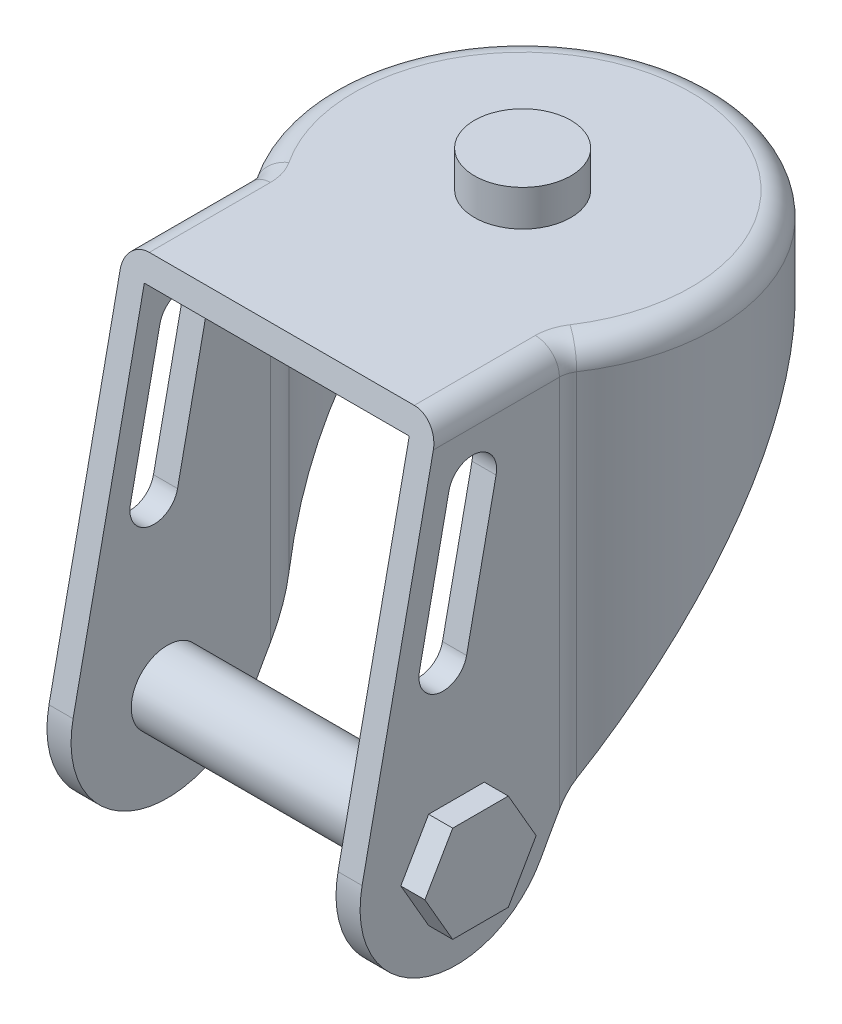
from build123d import *

# Parameters (mm, degrees)
BASE_EXTRUDE_DEPTH              = 33.02
SKETCH3_OUTSIDE_W               = 90.796
SKETCH3_OUTSIDE_H               = 92.225
CUT_EXTRUDE1_DEPTH              = 84.020179032
FILLET1_R                       = 3.175
SHELL1_START                    = -64
SHELL1_DEPTH                    = 60.825
CUT_EXTRUDE2_DEPTH              = 90.002703004
BOSS_EXTRUDE2_REACH             = 82.294
SKETCH5_R                       = 4.7625
BOSS_EXTRUDE2_DIRECTION_2_REACH = 82.294
BOSS_EXTRUDE3_DEPTH             = 3.175
SKETCH7_R                       = 6.35
BOSS_EXTRUDE4_DEPTH             = 4.7625


with BuildPart() as part:
    # Sketch2 → Base-Extrude (new, symmetric)
    with BuildSketch(Plane.ZY):
        with BuildLine():
            Line((-25.4, 0), (31.75, 0))
            Line((31.75, 0), (41.801384237, -48.20777973))
            ThreePointArc((41.801384237, -48.20777973), (33.708556891, -62.735496477), (18.174681196, -56.798568464))
            ThreePointArc((18.174681196, -56.798568464), (-0.820496403, -29.162568375), (-25.4, -6.35))
            Line((-25.4, -6.35), (-25.4, 0))
        make_face()
    extrude(amount=BASE_EXTRUDE_DEPTH, both=True)

    # Sketch3 outside → Cut-Extrude1 (cut, through all)
    with BuildSketch(Plane(origin=(0, 0, 0), x_dir=(-1, 0, 0), z_dir=(0, 1, 0))):
        with Locations((0, 8.3345)):
            Rectangle(SKETCH3_OUTSIDE_W, SKETCH3_OUTSIDE_H)
        with BuildLine():
            Line((20.6375, 14.807214247), (20.6375, 48.151384237))
            Line((20.6375, 48.151384237), (-20.6375, 48.151384237))
            Line((-20.6375, 48.151384237), (-20.6375, 14.807214247))
            ThreePointArc((-20.6375, 14.807214247), (0, -25.4), (20.6375, 14.807214247))
        make_face(mode=Mode.SUBTRACT)
    extrude(amount=-CUT_EXTRUDE1_DEPTH, mode=Mode.SUBTRACT)

    # Fillet1
    # the kernel refuses this fillet: 3.175 mm, written as the material it adds along each edge
    with BuildSketch(Plane(origin=(20.6375, 0, 14.807214247), x_dir=(0.567961525786319, 0, -0.8230551046111534), z_dir=(0, -1, 0))) as fillet1_piece_1_section:
        with BuildLine():
            CenterArc((0.989925475, 3.174465965), FILLET1_R, 235.391801271, 33.557309762)
            Line((-0.813352369, 0.561266008), (0, 0))
            ThreePointArc((0, 0), (0.465847282, 0.004272282), (0.931694565, 0))
        make_face()
    fillet1_piece_1 = extrude(amount=53.310385567, mode=Mode.PRIVATE)
    fillet1_piece_1 = fillet1_piece_1 - Plane(origin=(20.6375, -128.781390034, -116.154144448), x_dir=(0, 0.4723282255219985, 0.8814227404459453), z_dir=(-1, 0, 0)) * Cylinder(152.4, 111, mode=Mode.PRIVATE)
    add(fillet1_piece_1)
    with BuildSketch(Plane(origin=(-20.6375, 0, 14.807214247), x_dir=(-0.5679615257863165, 0, -0.8230551046111549), z_dir=(0, -1, 0))) as fillet1_piece_2_section:
        with BuildLine():
            CenterArc((0.989925475, -3.174465965), FILLET1_R, 91.050888967, 33.557309762)
            Line((-0.813352369, -0.561266008), (0, 0))
            ThreePointArc((0, 0), (0.465847282, -0.004272282), (0.931694565, 0))
        make_face()
    fillet1_piece_2 = extrude(amount=53.310385567, mode=Mode.PRIVATE)
    fillet1_piece_2 = fillet1_piece_2 - Plane(origin=(-20.6375, -128.781390034, -116.154144448), x_dir=(0, 0.4723282255219985, 0.8814227404459453), z_dir=(-1, 0, 0)) * Cylinder(152.4, 111, mode=Mode.PRIVATE)
    add(fillet1_piece_2)
    # the kernel refuses this fillet: 3.175 mm, written as the material it takes off along each edge
    with BuildSketch(Plane(origin=(0, 0, 0), x_dir=(-0.8333333333333335, 0, 0.5527707983925666), z_dir=(0.5527707983925666, 0, 0.8333333333333335))) as fillet1_2_piece_1:
        with BuildLine():
            CenterArc((25.4 - FILLET1_R, FILLET1_R), FILLET1_R, 270, 90)
            Line((25.4 - FILLET1_R, 0), (25.4, 0))
            Line((25.4, 0), (25.4, FILLET1_R))
        make_face()
    revolve(axis=Axis((0, 0, 0), (0, -1, 0)), revolution_arc=247.114619524, mode=Mode.SUBTRACT)
    with BuildSketch(Plane(origin=(20.6375, 0, 39.6875), x_dir=(-1, 0, 0), z_dir=(0, 0, -1)), Plane(origin=(-20.6375, 0, 15.795425564), x_dir=(1, 0, 0), z_dir=(0, 0, 1))) as fillet1_2_piece_2:
        with BuildLine():
            CenterArc((FILLET1_R, -FILLET1_R), FILLET1_R, 90, 90)
            Line((0, -FILLET1_R), (0, 0))
            Line((0, 0), (FILLET1_R, 0))
        make_face()
    extrude(amount=23.892074436, mode=Mode.SUBTRACT)
    with BuildSketch(Plane(origin=(-23.8125, 0, 15.795425564), x_dir=(0.8333333333333333, 0, -0.5527707983925668), z_dir=(-0.5527707983925668, 0, -0.8333333333333333))) as fillet1_2_piece_3:
        with BuildLine():
            CenterArc((3.175 + FILLET1_R, FILLET1_R), FILLET1_R, 180, 90)
            Line((3.175, FILLET1_R), (3.175, 0))
            Line((3.175, 0), (3.175 + FILLET1_R, 0))
        make_face()
    revolve(axis=Axis((-23.8125, 0, 15.795425564), (0, -1, 0)), revolution_arc=33.557309762, mode=Mode.SUBTRACT)
    with BuildSketch(Plane(origin=(23.8125, 0, 15.795425564), x_dir=(-0.8333333333333333, 0, -0.5527707983925668), z_dir=(0.5527707983925668, 0, -0.8333333333333333))) as fillet1_2_piece_4:
        with BuildLine():
            CenterArc((3.175 + FILLET1_R, -FILLET1_R), FILLET1_R, 90, 90)
            Line((3.175, -FILLET1_R), (3.175, 0))
            Line((3.175, 0), (3.175 + FILLET1_R, 0))
        make_face()
    revolve(axis=Axis((23.8125, 0, 15.795425564), (0, 1, 0)), revolution_arc=33.557309762, mode=Mode.SUBTRACT)

    # Shell1: read off the stored shape, not the designer's step
    # Shell1 outline → Shell1 (cut)
    with BuildSketch(Plane(origin=(0, 0, 0), x_dir=(1, 0, 0), z_dir=(0, 1, 0)).offset(SHELL1_START)):
        with BuildLine():
            ThreePointArc((17.4625, -15.795425564), (17.732837866, -13.962338459), (18.520833333, -12.285330994))
            ThreePointArc((18.520833333, -12.285330994), (0, 22.225), (-18.520833333, -12.285330994))
            ThreePointArc((-18.520833333, -12.285330994), (-17.732837866, -13.962338459), (-17.4625, -15.795425564))
            Line((-17.4625, -15.795425564), (-17.4625, -44))
            Line((-17.4625, -44), (17.4625, -44))
            Line((17.4625, -44), (17.4625, -15.795425564))
        make_face()
    extrude(amount=SHELL1_DEPTH, mode=Mode.SUBTRACT)

    # Sketch4 → Cut-Extrude2 (cut, through all)
    with BuildSketch(Plane.ZY.offset(-20.6375)):
        with BuildLine():
            Line((24.14125847, -10.173055068), (28.029588875, -28.822006423))
            ThreePointArc((28.029588875, -28.822006423), (31.785802502, -31.282109915), (34.245905994, -27.525896288))
            Line((34.245905994, -27.525896288), (30.357575589, -8.876944932))
            ThreePointArc((30.357575589, -8.876944932), (26.601361962, -6.416841441), (24.14125847, -10.173055068))
        make_face()
    extrude(amount=CUT_EXTRUDE2_DEPTH, mode=Mode.SUBTRACT)

    # Sketch5 → Boss-Extrude2 (add, up to next)
    with BuildSketch(Plane(origin=(0, 0, 0), x_dir=(0, 0, -1), z_dir=(1, 0, 0)), mode=Mode.PRIVATE) as boss_extrude2_sk1:
        with Locations((-29.36875, -50.8)):
            Circle(SKETCH5_R)
    boss_extrude2_tool1 = extrude(boss_extrude2_sk1.sketch, amount=BOSS_EXTRUDE2_REACH, mode=Mode.PRIVATE) - part.part
    add(boss_extrude2_tool1.solids().sort_by_distance((0, -50.8, 29.36875))[0])

    # Sketch5 → Boss-Extrude2 direction 2 (add, up to next)
    with BuildSketch(Plane(origin=(0, 0, 0), x_dir=(0, 0, -1), z_dir=(1, 0, 0)), mode=Mode.PRIVATE) as boss_extrude2_direction_2_sk1:
        with Locations((-29.36875, -50.8)):
            Circle(SKETCH5_R)
    boss_extrude2_direction_2_tool1 = extrude(boss_extrude2_direction_2_sk1.sketch, amount=-BOSS_EXTRUDE2_DIRECTION_2_REACH, mode=Mode.PRIVATE) - part.part
    add(boss_extrude2_direction_2_tool1.solids().sort_by_distance((0, -50.8, 29.36875))[0])

    # Sketch6 → Boss-Extrude3 (add)
    with BuildSketch(Plane.ZY.offset(20.6375)):
        Polygon((33.034924209, -44.45), (25.702575791, -44.45), (22.036401581, -50.8), (25.702575791, -57.15), (33.034924209, -57.15), (36.701098419, -50.8), align=None)
    boss_extrude3 = extrude(amount=BOSS_EXTRUDE3_DEPTH)

    # Mirror1: Boss-Extrude3 across plane
    add(boss_extrude3.mirror(Plane(origin=(0, 0, 0), x_dir=(0, 0, 1), z_dir=(1, 0, 0))))

    # Sketch7 → Boss-Extrude4 (add)
    with BuildSketch(Plane(origin=(0, 0, 0), x_dir=(-1, 0, 0), z_dir=(0, 1, 0))):
        with Locations(Location((0, 0, 0), (0, 0, 270))):
            Circle(SKETCH7_R)
    extrude(amount=BOSS_EXTRUDE4_DEPTH)


solid = part.part
